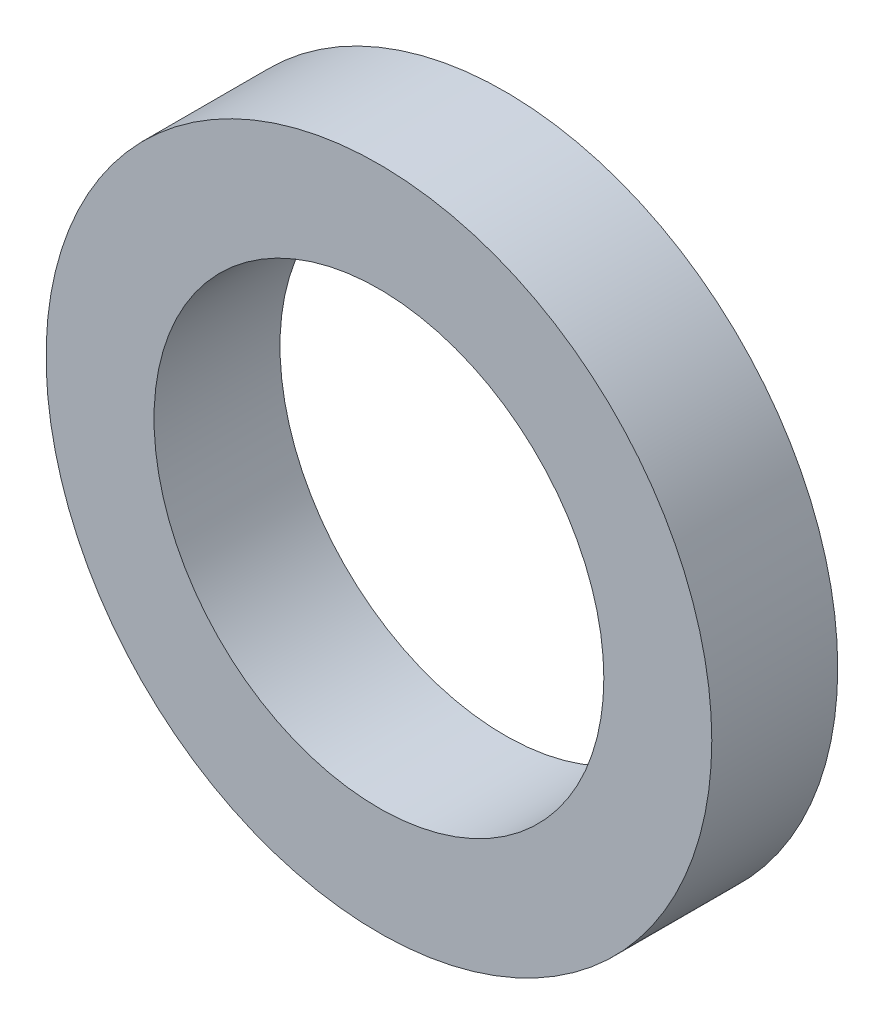
from build123d import *

# Parameters (mm, degrees)
EXTRUDE_2_DEPTH        = 3.5
EXTRUDE_2_DEPTH_BACK   = 3.5
SKETCH_1_R             = 18.5
SKETCH_1_R_2           = 17
EXTRUDE_2_2_DEPTH      = 3.5
EXTRUDE_2_2_DEPTH_BACK = 3.5
SKETCH_1_R_3           = 14
SKETCH_1_R_4           = 12.5
EXTRUDE_3_DEPTH        = 3.5
EXTRUDE_3_DEPTH_BACK   = 3.5
SKETCH_1_4_R           = 17
SKETCH_1_4_R_2         = 14


with BuildPart() as part:
    # Эскиз1 → Бобышка-Вытянуть2 (new, two sides: drawn at the far end of the back side and taken through both)
    with BuildSketch(Plane.XY.offset(-EXTRUDE_2_DEPTH_BACK)):
        Circle(SKETCH_1_R)
        Circle(SKETCH_1_R_2, mode=Mode.SUBTRACT)
    extrude(amount=EXTRUDE_2_DEPTH + EXTRUDE_2_DEPTH_BACK)



with BuildPart() as body_2:
    # Эскиз1 → Extrude 2 2 (new, two sides: drawn at the far end of the back side and taken through both)
    with BuildSketch(Plane.XY.offset(-EXTRUDE_2_2_DEPTH_BACK)):
        Circle(SKETCH_1_R_3)
        Circle(SKETCH_1_R_4, mode=Mode.SUBTRACT)
    extrude(amount=EXTRUDE_2_2_DEPTH + EXTRUDE_2_2_DEPTH_BACK)


with BuildPart() as part_1:
    add(part.part)

    add(body_2.part)  # Бобышка-Вытянуть3 merges body 2
    # Эскиз1<4> → Бобышка-Вытянуть3 (add, two sides: drawn at the far end of the back side and taken through both)
    with BuildSketch(Plane.XY.offset(-EXTRUDE_3_DEPTH_BACK)):
        Circle(SKETCH_1_4_R)
        Circle(SKETCH_1_4_R_2, mode=Mode.SUBTRACT)
    extrude(amount=EXTRUDE_3_DEPTH + EXTRUDE_3_DEPTH_BACK)


solid = part_1.part
